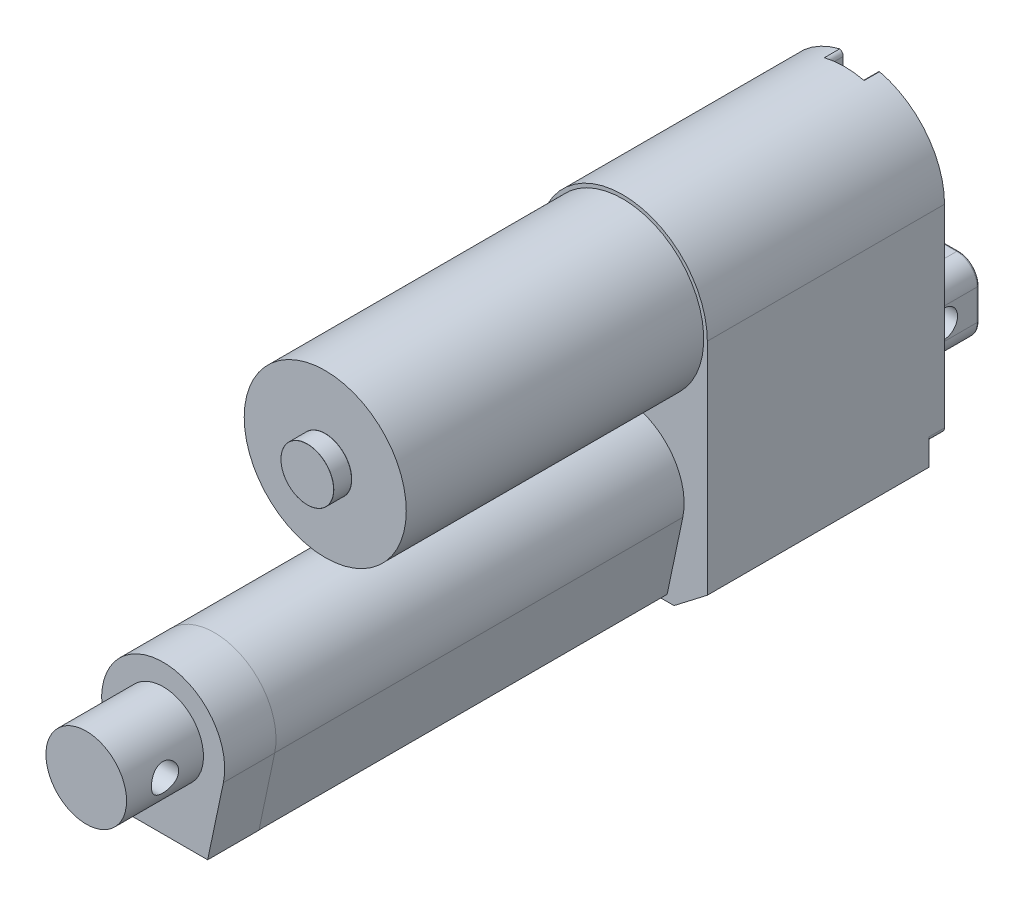
from build123d import *

# Parameters (mm, degrees)
BOSS_EXTRUDE1_DEPTH                      = 58.7375
SKETCH2_R                                = 20.066
BOSS_EXTRUDE2_DEPTH                      = 73.66
EDIT_LENGTH_HERE_HOVER_FOR_COMMENT_DEPTH = 113.792
SKETCH4_R                                = 9.9822
BOSS_EXTRUDE4_DEPTH                      = 19.05
BOSS_EXTRUDE5_DEPTH                      = 20.6502
CUT_EXTRUDE3_DEPTH                       = 211.434564151
CUT_EXTRUDE3_DEPTH_BACK                  = 211.434564151
SKETCH6_R                                = 3.3782
FILLET1_R                                = 2.54
FILLET2_R                                = 0.508
CUT_EXTRUDE5_DEPTH                       = 3.81
SKETCH8_R                                = 6.5405
BOSS_EXTRUDE6_DEPTH                      = 4.445
FILLET3_R                                = 0.0254
BOSS_EXTRUDE7_START                      = -12.7
BOSS_EXTRUDE7_DEPTH                      = 12.7
SKETCH10_R                               = 2.54
BOSS_EXTRUDE8_DEPTH                      = 0.635


with BuildPart() as part:
    # Sketch1 → Boss-Extrude1 (new body)
    with BuildSketch(Plane.XY):
        with BuildLine():
            Line((-12.7, 0), (12.7, 0))
            Line((12.7, 0), (20.955, 6.35))
            Line((20.955, 6.35), (20.955, 60.833))
            ThreePointArc((20.955, 60.833), (0, 81.788), (-20.955, 60.833))
            Line((-20.955, 60.833), (-20.955, 6.35))
            Line((-20.955, 6.35), (-12.7, 0))
        make_face()
    extrude(amount=BOSS_EXTRUDE1_DEPTH)

    # Sketch2 → Boss-Extrude2 (add)
    with BuildSketch(Plane.XY.offset(58.7375)):
        with Locations((0, 60.833)):
            Circle(SKETCH2_R)
    extrude(amount=BOSS_EXTRUDE2_DEPTH)

    # Sketch3 → EDIT_LENGTH_HERE (hover for comment) (add)
    with BuildSketch(Plane.XY.offset(58.7375)):
        with BuildLine():
            Line((-14.88814822, 20.042680112), (-10.996912775, 1.5621))
            Line((-10.996912775, 1.5621), (10.996912775, 1.5621))
            Line((10.996912775, 1.5621), (14.88814822, 20.042680112))
            ThreePointArc((14.88814822, 20.042680112), (0, 38.3921), (-14.88814822, 20.042680112))
        make_face()
    extrude(amount=EDIT_LENGTH_HERE_HOVER_FOR_COMMENT_DEPTH)

    # Sketch4 → Boss-Extrude4 (add)
    with BuildSketch(Plane.XY.offset(172.5295)):
        with Locations((0, 23.1775)):
            Circle(SKETCH4_R)
    extrude(amount=BOSS_EXTRUDE4_DEPTH)

    # Sketch5 → Boss-Extrude5 (add)
    with BuildSketch(Plane(origin=(0, 0, 0), x_dir=(-1, 0, 0), z_dir=(0, 0, -1))):
        with BuildLine():
            Line((-3.81, 32.0675), (3.81, 32.0675))
            ThreePointArc((3.81, 32.0675), (7.402102448, 30.579602448), (8.89, 26.9875))
            Line((8.89, 26.9875), (8.89, 19.3675))
            ThreePointArc((8.89, 19.3675), (7.402102448, 15.775397552), (3.81, 14.2875))
            Line((3.81, 14.2875), (-3.81, 14.2875))
            ThreePointArc((-3.81, 14.2875), (-7.402102448, 15.775397552), (-8.89, 19.3675))
            Line((-8.89, 19.3675), (-8.89, 26.9875))
            ThreePointArc((-8.89, 26.9875), (-7.402102448, 30.579602448), (-3.81, 32.0675))
        make_face()
    extrude(amount=BOSS_EXTRUDE5_DEPTH)

    # Sketch6 → Cut-Extrude3 (cut, two sides: drawn at the far end of the back side and taken through both)
    with BuildSketch(Plane(origin=(8.89, 0, 0), x_dir=(0, 0, -1), z_dir=(1, 0, 0)).offset(-CUT_EXTRUDE3_DEPTH_BACK)):
        with Locations((11.90625, 23.1775)):
            Circle(SKETCH6_R)
        with Locations((-182.0545, 23.1775)):
            Circle(SKETCH6_R)
    extrude(amount=CUT_EXTRUDE3_DEPTH + CUT_EXTRUDE3_DEPTH_BACK, mode=Mode.SUBTRACT)

    # Fillet1
    fillet1_edges = [part.edges().sort_by_distance(p)[0] for p in [
        (-7.402102448, 15.775397552, 0),
        (0, 14.2875, 0),
        (7.402102448, 15.775397552, 0),
        (8.89, 23.1775, 0),
        (7.402102448, 30.579602448, 0),
        (0, 32.0675, 0),
        (-7.402102448, 30.579602448, 0),
        (-8.89, 23.1775, 0),
    ]]
    fillet(fillet1_edges, radius=FILLET1_R)

    # Fillet2
    fillet2_edges = [part.edges().sort_by_distance(p)[0] for p in [
        (8.89, 23.1775, -20.6502),
        (7.402102448, 30.579602448, -20.6502),
        (0, 32.0675, -20.6502),
        (-7.402102448, 30.579602448, -20.6502),
        (-8.89, 23.1775, -20.6502),
        (-7.402102448, 15.775397552, -20.6502),
        (0, 14.2875, -20.6502),
        (7.402102448, 15.775397552, -20.6502),
    ]]
    fillet(fillet2_edges, radius=FILLET2_R)

    # Sketch7 → Cut-Extrude5 (cut)
    with BuildSketch(Plane(origin=(0, 0, 0), x_dir=(-1, 0, 0), z_dir=(0, 0, -1))):
        with BuildLine():
            ThreePointArc((-19.685, 11.610879552), (-20.583025612, 11.98285394), (-20.955, 12.880879552))
            Line((-20.955, 12.880879552), (-20.955, 6.35))
            Line((-20.955, 6.35), (-13.042377801, 0.26336754))
            ThreePointArc((-13.042377801, 0.26336754), (-13.507857108, 0.994743297), (-13.395607029, 1.854383572))
            Line((-13.395607029, 1.854383572), (-11.222314297, 6.047728836))
            ThreePointArc((-11.222314297, 6.047728836), (-11.349573436, 9.780348644), (-14.605, 11.610879552))
            Line((-14.605, 11.610879552), (-19.685, 11.610879552))
        make_face()
        with BuildLine():
            Line((20.955, 6.35), (20.955, 12.880879552))
            ThreePointArc((20.955, 12.880879552), (20.583025612, 11.98285394), (19.685, 11.610879552))
            Line((19.685, 11.610879552), (14.605, 11.610879552))
            ThreePointArc((14.605, 11.610879552), (11.203032914, 9.51631534), (11.541558483, 5.535614431))
            Line((11.541558483, 5.535614431), (13.402295436, 1.841293477))
            ThreePointArc((13.402295436, 1.841293477), (13.506243345, 0.987572709), (13.042377827, 0.263367559))
            Line((13.042377827, 0.263367559), (20.955, 6.35))
        make_face()
        with BuildLine():
            Line((-4.1275, 80.068311519), (-4.1275, 77.089))
            ThreePointArc((-4.1275, 77.089), (0, 72.9615), (4.1275, 77.089))
            Line((4.1275, 77.089), (4.1275, 79.978628931))
            ThreePointArc((4.1275, 79.978628931), (4.367379625, 80.721429048), (4.996400809, 81.183626623))
            ThreePointArc((4.996400809, 81.183626623), (0.071861599, 81.787876781), (-4.856706104, 81.217416372))
            ThreePointArc((-4.856706104, 81.217416372), (-4.325187488, 80.748786262), (-4.1275, 80.068311519))
        make_face()
    extrude(amount=-CUT_EXTRUDE5_DEPTH, mode=Mode.SUBTRACT)

    # Sketch8 → Boss-Extrude6 (add)
    with BuildSketch(Plane.XY.offset(132.3975)):
        with Locations((0, 60.833)):
            Circle(SKETCH8_R)
    extrude(amount=BOSS_EXTRUDE6_DEPTH)

    # Fillet3
    fillet3_edges = [part.edges().sort_by_distance(p)[0] for p in [
        (-6.5405, 60.833, 132.3975),
        (-6.5405, 60.833, 136.8425),
    ]]
    fillet(fillet3_edges, radius=FILLET3_R)

    # Sketch9 → Boss-Extrude7 (add)
    with BuildSketch(Plane.XY.offset(172.5295).offset(BOSS_EXTRUDE7_START)):
        with BuildLine():
            Line((-11.017521545, 1.5367), (11.017521545, 1.5367))
            Line((11.017521545, 1.5367), (14.913003226, 20.03744669))
            ThreePointArc((14.913003226, 20.03744669), (0, 38.4175), (-14.913003226, 20.03744669))
            Line((-14.913003226, 20.03744669), (-11.017521545, 1.5367))
        make_face()
        with BuildLine():
            Line((10.996912775, 1.5621), (14.88814822, 20.042680112))
            ThreePointArc((14.88814822, 20.042680112), (0, 38.3921), (-14.88814822, 20.042680112))
            Line((-14.88814822, 20.042680112), (-10.996912775, 1.5621))
            Line((-10.996912775, 1.5621), (10.996912775, 1.5621))
        make_face(mode=Mode.SUBTRACT)
    extrude(amount=BOSS_EXTRUDE7_DEPTH)

    # Sketch10 → Boss-Extrude8 (add)
    with BuildSketch(Plane(origin=(0, 0, 3.81), x_dir=(-1, 0, 0), z_dir=(0, 0, -1))):
        with Locations((0, 77.089)):
            Circle(SKETCH10_R)
        with Locations((-14.605, 7.800879552)):
            Circle(SKETCH10_R)
        with Locations((14.605, 7.800879552)):
            Circle(SKETCH10_R)
    extrude(amount=BOSS_EXTRUDE8_DEPTH)


solid = part.part
